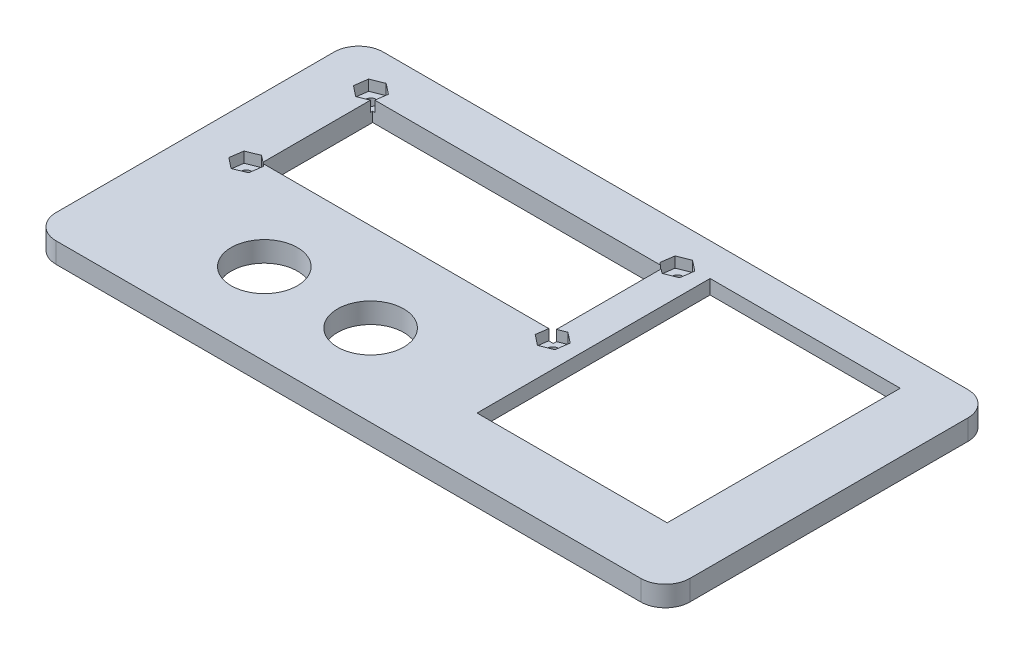
from build123d import *

# Parameters (mm, degrees)
SKETCH1_W                = 155
SKETCH1_H                = 80
BOSS_EXTRUDE1_DEPTH      = 5
SKETCH2_R                = 1.27
SKETCH2_W                = 71.2978
SKETCH2_H                = 27.1018
SCREEN_CUTOUT_DEPTH      = 88.357026048
SCREEN_HEX_NUTS_DEPTH    = 2.6
SKETCH3_R                = 8.1
ULTRASOUND_CUTOUTS_DEPTH = 88.357026048
SKETCH3_3_R              = 8.1
SKETCH3_3_R_2            = 1.190625
CUT_EXTRUDE2_DEPTH       = 3.175
SKETCH5_W                = 12
SKETCH5_H                = 5
US_CLOCK_CUTOUT_DEPTH    = 4
SKETCH6_W                = 10
SKETCH6_H                = 3.5
US_PIN_CUTOUT_DEPTH      = 2
SKETCH9_R                = 3.15
MAGNET_HOLES_DEPTH       = 2.1
FILLET1_R                = 6
SKETCH10_W               = 46.5
SKETCH10_H               = 57
KEYPAD_CUTOUT_DEPTH      = 88.357026048
CUT_EXTRUDE1_DEPTH       = 1.5


with BuildPart() as part:
    # Sketch1 → Boss-Extrude1 (new body)
    with BuildSketch(Plane(origin=(0, 0, 0), x_dir=(1, 0, 0), z_dir=(0, 1, 0))):
        Rectangle(SKETCH1_W, SKETCH1_H)
    extrude(amount=BOSS_EXTRUDE1_DEPTH)

    # Sketch2 → Screen Cutout (cut, through all)
    with BuildSketch(Plane(origin=(0, 5, 0), x_dir=(1, 0, 0), z_dir=(0, 1, 0))):
        with Locations((-64.96, -0.02)):
            Circle(SKETCH2_R)
        with Locations((9.97, -0.02)):
            Circle(SKETCH2_R)
        with Locations((9.97, 30.46)):
            Circle(SKETCH2_R)
        with Locations((-64.96, 30.46)):
            Circle(SKETCH2_R)
        with Locations((-27.2029, 15.22)):
            Rectangle(SKETCH2_W, SKETCH2_H)
    extrude(amount=-SCREEN_CUTOUT_DEPTH, mode=Mode.SUBTRACT)

    # Sketch8 → Screen hex nuts (cut)
    with BuildSketch(Plane(origin=(0, 5, 0), x_dir=(1, 0, 0), z_dir=(0, 1, 0))):
        Polygon((-68.013462423, 29.232658469), (-65.423822267, 27.201953207), (-62.370359844, 28.429294738), (-61.906537577, 31.687341531), (-64.496177733, 33.718046793), (-67.549640156, 32.490705262), align=None)
        Polygon((6.916537856, 29.232657776), (9.506178473, 27.201953102), (12.559640617, 28.429295326), (13.023462144, 31.687342224), (10.433821527, 33.718046898), (7.380359383, 32.490704674), align=None)
        Polygon((6.916537628, -1.247341658), (9.506177869, -3.278046812), (12.559640241, -2.050705154), (13.023462372, 1.207341658), (10.433822131, 3.238046812), (7.380359759, 2.010705154), align=None)
        Polygon((-68.013462387, -1.247341619), (-65.423822172, -3.278046806), (-62.370359785, -2.050705187), (-61.906537613, 1.207341619), (-64.496177828, 3.238046806), (-67.549640215, 2.010705187), align=None)
    extrude(amount=-SCREEN_HEX_NUTS_DEPTH, mode=Mode.SUBTRACT)

    # Sketch3 → Ultrasound Cutouts (cut, through all)
    with BuildSketch(Plane(origin=(0, 0, 0), x_dir=(1, 0, 0), z_dir=(0, 1, 0))):
        with Locations((-40.58183153, -20)):
            Circle(SKETCH3_R)
        with Locations((-14.58183153, -20)):
            Circle(SKETCH3_R)
    extrude(amount=ULTRASOUND_CUTOUTS_DEPTH, mode=Mode.SUBTRACT)

    # Sketch3<3> → Cut-Extrude2 (cut)
    with BuildSketch(Plane(origin=(0, 0, 0), x_dir=(1, 0, 0), z_dir=(0, 1, 0))):
        with Locations((-40.58183153, -20)):
            Circle(SKETCH3_3_R)
        with Locations((-14.58183153, -20)):
            Circle(SKETCH3_3_R)
        with Locations((-48.73183153, -11.45)):
            Circle(SKETCH3_3_R_2)
        with Locations((-6.43183153, -11.45)):
            Circle(SKETCH3_3_R_2)
        with Locations((-6.43183153, -28.55)):
            Circle(SKETCH3_3_R_2)
        with Locations((-48.73183153, -28.55)):
            Circle(SKETCH3_3_R_2)
    extrude(amount=CUT_EXTRUDE2_DEPTH, mode=Mode.SUBTRACT)

    # Sketch5 → US Clock cutout (cut)
    with BuildSketch(Plane.XZ):
        with Locations((-27.471992442, 27.55)):
            Rectangle(SKETCH5_W, SKETCH5_H)
    extrude(amount=-US_CLOCK_CUTOUT_DEPTH, mode=Mode.SUBTRACT)

    # Sketch6 → US Pin cutout (cut)
    with BuildSketch(Plane.XZ):
        with Locations((-27.471992442, 11.55)):
            Rectangle(SKETCH6_W, SKETCH6_H)
    extrude(amount=-US_PIN_CUTOUT_DEPTH, mode=Mode.SUBTRACT)

    # Sketch9 → Magnet Holes (cut)
    with BuildSketch(Plane(origin=(0, 0.2, 0), x_dir=(-1, 0, 0), z_dir=(0, -1, 0))):
        with Locations((-71.5, 34)):
            Circle(SKETCH9_R)
        with Locations((71.5, 34)):
            Circle(SKETCH9_R)
        with Locations((-71.5, -34)):
            Circle(SKETCH9_R)
        with Locations((71.5, -34)):
            Circle(SKETCH9_R)
    extrude(amount=-MAGNET_HOLES_DEPTH, mode=Mode.SUBTRACT)

    # Fillet1
    fillet1_edges = [part.edges().sort_by_distance(p)[0] for p in [
        (77.5, 2.5, -40),
        (77.5, 2.5, 40),
        (-77.5, 2.5, 40),
        (-77.5, 2.5, -40),
    ]]
    fillet(fillet1_edges, radius=FILLET1_R)

    # Sketch10 → Keypad cutout (cut, through all)
    with BuildSketch(Plane(origin=(0, 5, 0), x_dir=(1, 0, 0), z_dir=(0, 1, 0))):
        with Locations((39.696, 3.5)):
            Rectangle(SKETCH10_W, SKETCH10_H)
    extrude(amount=-KEYPAD_CUTOUT_DEPTH, mode=Mode.SUBTRACT)

    # Sketch11 → Cut-Extrude1 (cut)
    with BuildSketch(Plane.XZ):
        Polygon((58.696, 28.5), (58.696, 34.5), (20.696, 34.5), (20.696, 28.5), (13.696, 28.5), (13.696, -35.5), (65.696, -35.5), (65.696, 28.5), align=None)
    extrude(amount=-CUT_EXTRUDE1_DEPTH, mode=Mode.SUBTRACT)


solid = part.part
